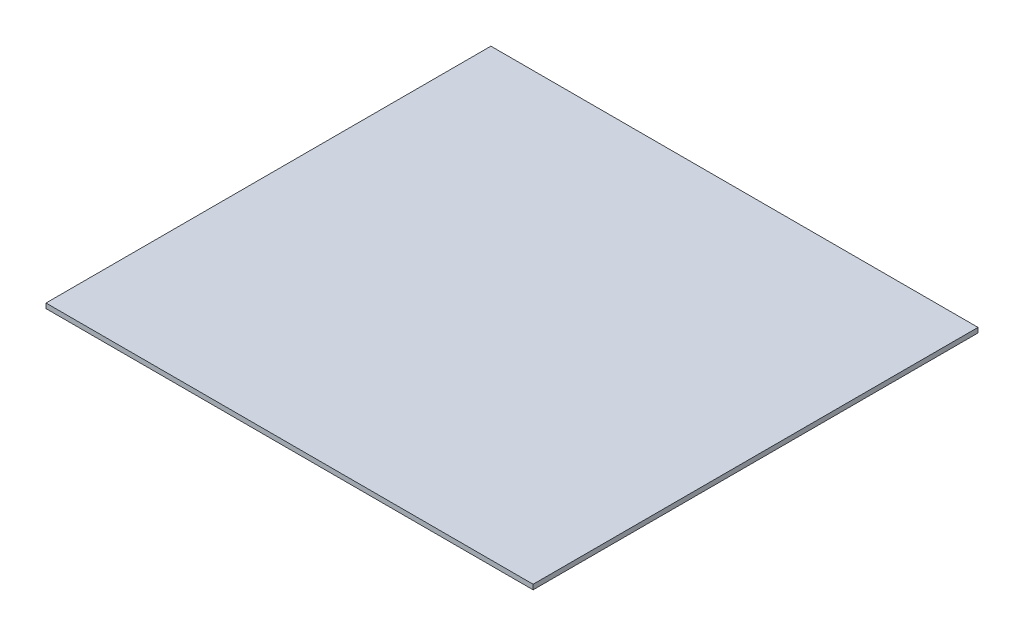
from build123d import *

# Parameters (mm, degrees)
SKETCH1_W           = 300
SKETCH1_H           = 274
BOSS_EXTRUDE1_DEPTH = 3


with BuildPart() as part:
    # Sketch1 → Boss-Extrude1 (new body)
    with BuildSketch(Plane(origin=(0, 0, 0), x_dir=(1, 0, 0), z_dir=(0, 1, 0))):
        with Locations((150, 137)):
            Rectangle(SKETCH1_W, SKETCH1_H)
    extrude(amount=BOSS_EXTRUDE1_DEPTH)


solid = part.part
